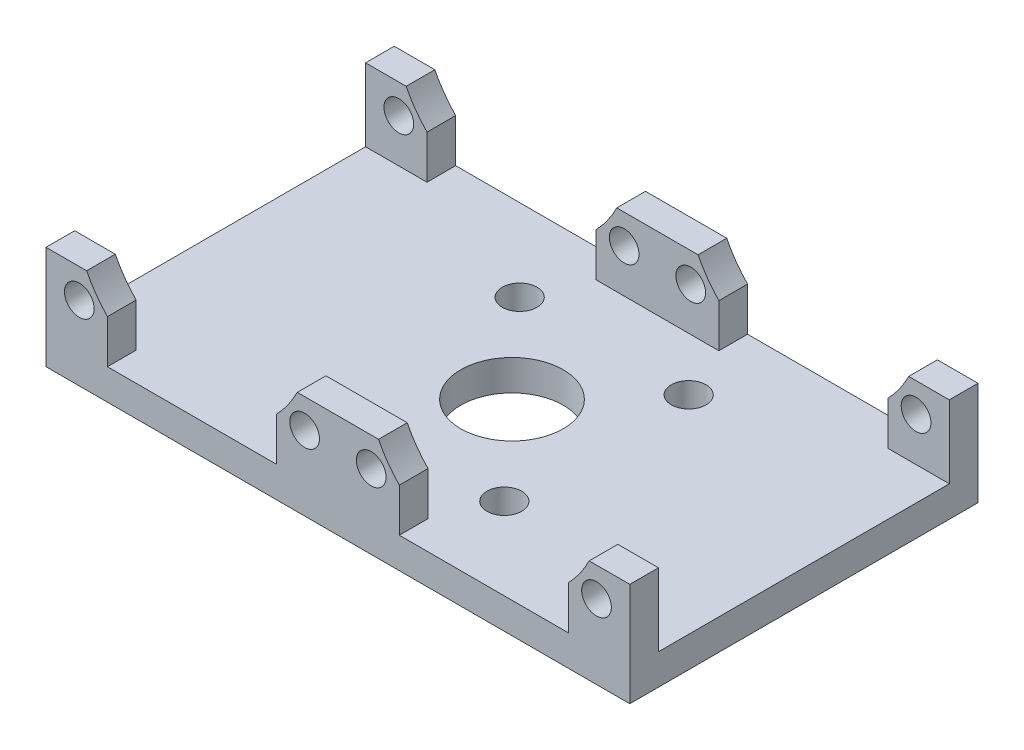
from build123d import *

# Parameters (mm, degrees)
SKETCH1_W           = 57
SKETCH1_H           = 34
SKETCH1_R           = 5
SKETCH1_R_2         = 1.7
BOSS_EXTRUDE1_DEPTH = 3
SKETCH6_R           = 1.45
BOSS_EXTRUDE3_DEPTH = 2.8


with BuildPart() as part:
    # Sketch1 → Boss-Extrude1 (new body)
    with BuildSketch(Plane(origin=(0, 0, 0), x_dir=(1, 0, 0), z_dir=(0, 1, 0))):
        Rectangle(SKETCH1_W, SKETCH1_H)
        Circle(SKETCH1_R, mode=Mode.SUBTRACT)
        with Locations((-8.25, 9)):
            Circle(SKETCH1_R_2, mode=Mode.SUBTRACT)
        with Locations((8.25, 9)):
            Circle(SKETCH1_R_2, mode=Mode.SUBTRACT)
        with Locations((8.25, -9)):
            Circle(SKETCH1_R_2, mode=Mode.SUBTRACT)
        with Locations((-8.25, -9)):
            Circle(SKETCH1_R_2, mode=Mode.SUBTRACT)
    extrude(amount=BOSS_EXTRUDE1_DEPTH)

    # Sketch6 → Boss-Extrude3 (add)
    # profile 1 of 3: a face of its own
    with BuildSketch(Plane.XY.offset(17)):
        with BuildLine():
            Line((-28.5, 10.1), (-28.5, 3))
            Line((-28.5, 3), (-22.5, 3))
            Line((-22.5, 3), (-22.5, 7.238289821))
            ThreePointArc((-22.5, 7.238289821), (-23.626017075, 8.591148462), (-24.532387855, 10.1))
            Line((-24.532387855, 10.1), (-28.5, 10.1))
        make_face()
        with Locations((-25.25, 7.25)):
            Circle(SKETCH6_R, mode=Mode.SUBTRACT)
    # profile 2 of 3: a face of its own
    with BuildSketch(Plane.XY.offset(17)):
        with BuildLine():
            Line((-6, 7.238289821), (-6, 3))
            Line((-6, 3), (6, 3))
            Line((6, 3), (6, 7.238289821))
            ThreePointArc((6, 7.238289821), (4.873982925, 8.591148462), (3.967612145, 10.1))
            Line((3.967612145, 10.1), (-3.967612145, 10.1))
            ThreePointArc((-3.967612145, 10.1), (-4.873982925, 8.591148462), (-6, 7.238289821))
        make_face()
        with Locations((-3.25, 7.25)):
            Circle(SKETCH6_R, mode=Mode.SUBTRACT)
        with Locations((3.25, 7.25)):
            Circle(SKETCH6_R, mode=Mode.SUBTRACT)
    # profile 3 of 3: a face of its own
    with BuildSketch(Plane.XY.offset(17)):
        with BuildLine():
            Line((22.5, 7.238289821), (22.5, 3))
            Line((22.5, 3), (28.5, 3))
            Line((28.5, 3), (28.5, 10.1))
            Line((28.5, 10.1), (24.532387855, 10.1))
            ThreePointArc((24.532387855, 10.1), (23.626017075, 8.591148462), (22.5, 7.238289821))
        make_face()
        with Locations((25.25, 7.25)):
            Circle(SKETCH6_R, mode=Mode.SUBTRACT)
    boss_extrude3 = extrude(amount=-BOSS_EXTRUDE3_DEPTH)

    # Mirror2: Boss-Extrude3 across plane
    add(boss_extrude3.mirror(Plane.XY))


solid = part.part
